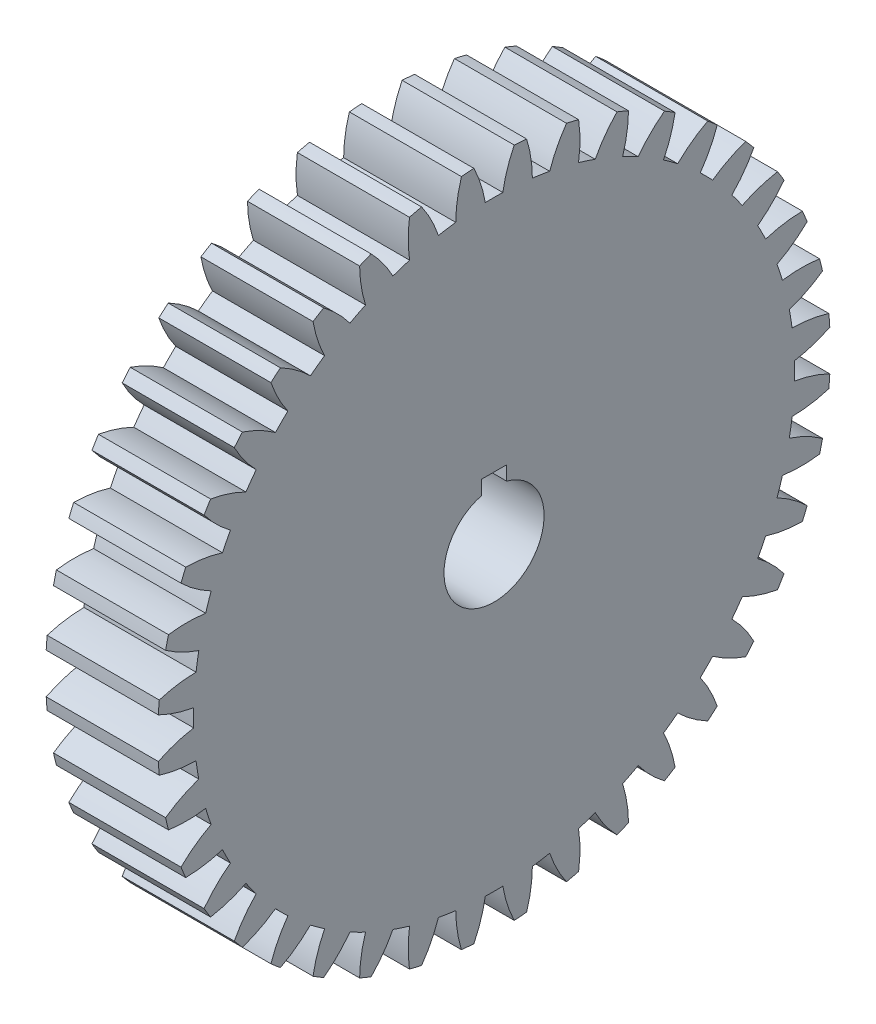
from build123d import *

# Parameters (mm, degrees)
SPUR_START             = -37.075031189
SPUR_GEAR_AI_OUTLINE_R = 3.96875
SPUR_GEAR_AI_DEPTH     = 8.89
SKETCH1_W              = 2
SKETCH1_H              = 2
CUT_EXTRUDE1_DEPTH     = 55.357122206


# Read off the part's stored shape, not the designer's step: spur gear_ai
with BuildPart() as part:
    # spur gear_ai outline → spur gear_ai (new body)
    with BuildSketch(Plane.YZ.offset(SPUR_START)):
        with BuildLine():
            ThreePointArc((34.87337661, 6.70347613), (34.993144006, 7.182744544), (35.104013782, 7.664149087))
            ThreePointArc((35.104013782, 7.664149087), (33.837241458, 8.426572892), (32.473226216, 8.997067938))
            ThreePointArc((32.473226216, 8.997067938), (32.591910481, 9.681649982), (32.690582523, 10.36940165))
            ThreePointArc((32.690582523, 10.36940165), (34.164130772, 10.49047079), (35.604504757, 10.824124742))
            ThreePointArc((35.604504757, 10.824124742), (35.64782352, 11.316228315), (35.682020042, 11.809049824))
            ThreePointArc((35.682020042, 11.809049824), (34.311574428, 12.363920075), (32.87510739, 12.714012386))
            ThreePointArc((32.87510739, 12.714012386), (32.885238229, 13.408732398), (32.87510739, 14.10345241))
            ThreePointArc((32.87510739, 14.10345241), (34.311574428, 14.453544721), (35.682020042, 15.008414972))
            ThreePointArc((35.682020042, 15.008414972), (35.64782352, 15.501236481), (35.604504757, 15.993340054))
            ThreePointArc((35.604504757, 15.993340054), (34.164130771, 16.326994005), (32.690582523, 16.448063146))
            ThreePointArc((32.690582523, 16.448063146), (32.591910481, 17.135814814), (32.473226216, 17.820396858))
            ThreePointArc((32.473226216, 17.820396858), (33.837241458, 18.390891904), (35.104013782, 19.153315708))
            ThreePointArc((35.104013782, 19.153315708), (34.993144006, 19.634720252), (34.87337661, 20.113988666))
            ThreePointArc((34.87337661, 20.113988666), (33.398541041, 20.21821065), (31.924195231, 20.107275496))
            ThreePointArc((31.924195231, 20.107275496), (31.719149941, 20.771124092), (31.494834651, 21.428711486))
            ThreePointArc((31.494834651, 21.428711486), (32.752811514, 22.205561785), (33.884718408, 23.156765738))
            ThreePointArc((33.884718408, 23.156765738), (33.699905361, 23.614899539), (33.506638403, 24.069531615))
            ThreePointArc((33.506638403, 24.069531615), (32.033656597, 23.94175534), (30.594816511, 23.601547484))
            ThreePointArc((30.594816511, 23.601547484), (30.288446869, 24.225146852), (29.96402394, 24.839547611))
            ThreePointArc((29.96402394, 24.839547611), (31.08498686, 25.803624532), (32.05415702, 26.920186836))
            ThreePointArc((32.05415702, 26.920186836), (31.799951412, 27.343769119), (31.537943765, 27.762570306))
            ThreePointArc((31.537943765, 27.762570306), (30.103085423, 27.405942048), (28.73518008, 26.844838537))
            ThreePointArc((28.73518008, 26.844838537), (28.335029924, 27.412833591), (27.918487725, 27.968919129))
            ThreePointArc((27.918487725, 27.968919129), (28.874834874, 29.096483898), (29.657404114, 30.350911083))
            ThreePointArc((29.657404114, 30.350911083), (29.340065332, 30.729511847), (29.015768494, 31.102169871))
            ThreePointArc((29.015768494, 31.102169871), (27.654364589, 30.525471001), (26.391076359, 29.757288064))
            ThreePointArc((26.391076359, 29.757288064), (25.906998712, 30.255692881), (25.408593896, 30.739770528))
            ThreePointArc((25.408593896, 30.739770528), (26.176776832, 32.003058759), (26.753475702, 33.364462663))
            ThreePointArc((26.753475702, 33.364462663), (26.380817678, 33.6887595), (26.002216914, 34.006098283))
            ThreePointArc((26.002216914, 34.006098283), (24.74778973, 33.223529042), (23.620224961, 32.267181894))
            ThreePointArc((23.620224961, 32.267181894), (23.064139422, 32.683724092), (22.496144368, 33.083874249))
            ThreePointArc((22.496144368, 33.083874249), (23.05724788, 34.451779592), (23.413876138, 35.886637934))
            ThreePointArc((23.413876138, 35.886637934), (22.99507495, 36.148645581), (22.571492667, 36.402851189))
            ThreePointArc((22.571492667, 36.402851189), (21.454930363, 35.433681029), (20.490853442, 34.312718109))
            ThreePointArc((20.490853442, 34.312718109), (19.876452683, 34.637141038), (19.252853315, 34.94351068))
            ThreePointArc((19.252853315, 34.94351068), (19.593061171, 36.382350766), (19.720837446, 37.855332572))
            ThreePointArc((19.720837446, 37.855332572), (19.26620537, 38.04859953), (18.80807157, 38.233412577))
            ThreePointArc((18.80807157, 38.233412577), (17.856867617, 37.101505683), (17.080017317, 35.843528819))
            ThreePointArc((17.080017317, 35.843528819), (16.422429923, 36.06784411), (15.758581327, 36.2728894))
            ThreePointArc((15.758581327, 36.2728894), (15.869516481, 37.74723521), (15.765294497, 39.222070779))
            ThreePointArc((15.765294497, 39.222070779), (15.286026083, 39.341838175), (14.80462154, 39.452707951))
            ThreePointArc((14.80462154, 39.452707951), (14.042197735, 38.185935627), (13.471702689, 36.821920385))
            ThreePointArc((13.471702689, 36.821920385), (12.787120645, 36.94060465), (12.099368977, 37.039276692))
            ThreePointArc((12.099368977, 37.039276692), (11.978299837, 38.512824941), (11.644645885, 39.953198926))
            ThreePointArc((11.644645885, 39.953198926), (11.152542312, 39.996517689), (10.659720803, 40.030714211))
            ThreePointArc((10.659720803, 40.030714211), (10.104850552, 38.660268597), (9.754758241, 37.223801559))
            ThreePointArc((9.754758241, 37.223801559), (9.060038229, 37.233932398), (8.365318217, 37.223801559))
            ThreePointArc((8.365318217, 37.223801559), (8.015225906, 38.660268597), (7.460355655, 40.030714211))
            ThreePointArc((7.460355655, 40.030714211), (6.967534146, 39.996517689), (6.475430573, 39.953198926))
            ThreePointArc((6.475430573, 39.953198926), (6.141776622, 38.51282494), (6.020707481, 37.039276692))
            ThreePointArc((6.020707481, 37.039276692), (5.332955813, 36.94060465), (4.648373769, 36.821920385))
            ThreePointArc((4.648373769, 36.821920385), (4.077878723, 38.185935627), (3.315454919, 39.452707951))
            ThreePointArc((3.315454919, 39.452707951), (2.834050375, 39.341838175), (2.354781961, 39.222070779))
            ThreePointArc((2.354781961, 39.222070779), (2.250559977, 37.74723521), (2.361495131, 36.2728894))
            ThreePointArc((2.361495131, 36.2728894), (1.697646535, 36.06784411), (1.040059141, 35.843528819))
            ThreePointArc((1.040059141, 35.843528819), (0.263208842, 37.101505683), (-0.687995111, 38.233412577))
            ThreePointArc((-0.687995111, 38.233412577), (-1.146128912, 38.04859953), (-1.600760988, 37.855332572))
            ThreePointArc((-1.600760988, 37.855332572), (-1.472984713, 36.382350766), (-1.132776857, 34.94351068))
            ThreePointArc((-1.132776857, 34.94351068), (-1.756376225, 34.637141038), (-2.370776984, 34.312718109))
            ThreePointArc((-2.370776984, 34.312718109), (-3.334853905, 35.433681029), (-4.451416209, 36.402851189))
            ThreePointArc((-4.451416209, 36.402851189), (-4.874998492, 36.148645581), (-5.293799679, 35.886637934))
            ThreePointArc((-5.293799679, 35.886637934), (-4.937171421, 34.451779592), (-4.37606791, 33.083874249))
            ThreePointArc((-4.37606791, 33.083874249), (-4.944062964, 32.683724092), (-5.500148502, 32.267181894))
            ThreePointArc((-5.500148502, 32.267181894), (-6.627713271, 33.223529042), (-7.882140456, 34.006098283))
            ThreePointArc((-7.882140456, 34.006098283), (-8.26074122, 33.6887595), (-8.633399244, 33.364462663))
            ThreePointArc((-8.633399244, 33.364462663), (-8.056700374, 32.003058758), (-7.288517437, 30.739770528))
            ThreePointArc((-7.288517437, 30.739770528), (-7.786922254, 30.255692881), (-8.270999901, 29.757288064))
            ThreePointArc((-8.270999901, 29.757288064), (-9.534288131, 30.525471001), (-10.895692036, 31.102169871))
            ThreePointArc((-10.895692036, 31.102169871), (-11.219988873, 30.729511847), (-11.537327656, 30.350911083))
            ThreePointArc((-11.537327656, 30.350911083), (-10.754758415, 29.096483899), (-9.798411267, 27.968919129))
            ThreePointArc((-9.798411267, 27.968919129), (-10.214953465, 27.412833591), (-10.615103622, 26.844838537))
            ThreePointArc((-10.615103622, 26.844838537), (-11.983008965, 27.405942048), (-13.417867307, 27.762570306))
            ThreePointArc((-13.417867307, 27.762570306), (-13.679874954, 27.343769119), (-13.934080562, 26.920186836))
            ThreePointArc((-13.934080562, 26.920186836), (-12.964910402, 25.803624533), (-11.843947482, 24.839547611))
            ThreePointArc((-11.843947482, 24.839547611), (-12.168370411, 24.225146852), (-12.474740053, 23.601547484))
            ThreePointArc((-12.474740053, 23.601547484), (-13.913580139, 23.94175534), (-15.386561945, 24.069531615))
            ThreePointArc((-15.386561945, 24.069531615), (-15.579828903, 23.614899539), (-15.76464195, 23.156765738))
            ThreePointArc((-15.76464195, 23.156765738), (-14.632735056, 22.205561785), (-13.374758192, 21.428711486))
            ThreePointArc((-13.374758192, 21.428711486), (-13.599073483, 20.771124092), (-13.804118773, 20.107275496))
            ThreePointArc((-13.804118773, 20.107275496), (-15.278464583, 20.21821065), (-16.753300152, 20.113988666))
            ThreePointArc((-16.753300152, 20.113988666), (-16.873067548, 19.634720252), (-16.983937324, 19.153315708))
            ThreePointArc((-16.983937324, 19.153315708), (-15.717165, 18.390891904), (-14.353149758, 17.820396858))
            ThreePointArc((-14.353149758, 17.820396858), (-14.471834023, 17.135814814), (-14.570506065, 16.448063146))
            ThreePointArc((-14.570506065, 16.448063146), (-16.044054313, 16.326994005), (-17.484428299, 15.993340054))
            ThreePointArc((-17.484428299, 15.993340054), (-17.527747062, 15.501236481), (-17.561943584, 15.008414972))
            ThreePointArc((-17.561943584, 15.008414972), (-16.19149797, 14.453544721), (-14.755030932, 14.10345241))
            ThreePointArc((-14.755030932, 14.10345241), (-14.765161771, 13.408732398), (-14.755030932, 12.714012386))
            ThreePointArc((-14.755030932, 12.714012386), (-16.19149797, 12.363920075), (-17.561943584, 11.809049824))
            ThreePointArc((-17.561943584, 11.809049824), (-17.527747062, 11.316228315), (-17.484428299, 10.824124742))
            ThreePointArc((-17.484428299, 10.824124742), (-16.044054314, 10.49047079), (-14.570506065, 10.36940165))
            ThreePointArc((-14.570506065, 10.36940165), (-14.471834023, 9.681649982), (-14.353149758, 8.997067938))
            ThreePointArc((-14.353149758, 8.997067938), (-15.717165, 8.426572892), (-16.983937324, 7.664149087))
            ThreePointArc((-16.983937324, 7.664149087), (-16.873067548, 7.182744544), (-16.753300152, 6.70347613))
            ThreePointArc((-16.753300152, 6.70347613), (-15.278464583, 6.599254146), (-13.804118773, 6.7101893))
            ThreePointArc((-13.804118773, 6.7101893), (-13.599073483, 6.046340704), (-13.374758192, 5.38875331))
            ThreePointArc((-13.374758192, 5.38875331), (-14.632735056, 4.61190301), (-15.76464195, 3.660699057))
            ThreePointArc((-15.76464195, 3.660699057), (-15.579828903, 3.202565257), (-15.386561945, 2.747933181))
            ThreePointArc((-15.386561945, 2.747933181), (-13.913580139, 2.875709456), (-12.474740053, 3.215917312))
            ThreePointArc((-12.474740053, 3.215917312), (-12.168370411, 2.592317944), (-11.843947482, 1.977917185))
            ThreePointArc((-11.843947482, 1.977917185), (-12.964910402, 1.013840263), (-13.934080562, -0.10272204))
            ThreePointArc((-13.934080562, -0.10272204), (-13.679874954, -0.526304323), (-13.417867307, -0.945105511))
            ThreePointArc((-13.417867307, -0.945105511), (-11.983008965, -0.588477253), (-10.615103622, -0.027373741))
            ThreePointArc((-10.615103622, -0.027373741), (-10.214953465, -0.595368795), (-9.798411267, -1.151454334))
            ThreePointArc((-9.798411267, -1.151454334), (-10.754758415, -2.279019103), (-11.537327656, -3.533446287))
            ThreePointArc((-11.537327656, -3.533446287), (-11.219988873, -3.912047051), (-10.895692036, -4.284705075))
            ThreePointArc((-10.895692036, -4.284705075), (-9.534288132, -3.708006205), (-8.270999901, -2.939823269))
            ThreePointArc((-8.270999901, -2.939823269), (-7.786922254, -3.438228085), (-7.288517437, -3.922305732))
            ThreePointArc((-7.288517437, -3.922305732), (-8.056700374, -5.185593962), (-8.633399244, -6.546997867))
            ThreePointArc((-8.633399244, -6.546997867), (-8.26074122, -6.871294705), (-7.882140456, -7.188633487))
            ThreePointArc((-7.882140456, -7.188633487), (-6.627713271, -6.406064246), (-5.500148502, -5.449717098))
            ThreePointArc((-5.500148502, -5.449717098), (-4.944062964, -5.866259296), (-4.37606791, -6.266409453))
            ThreePointArc((-4.37606791, -6.266409453), (-4.937171421, -7.634314796), (-5.293799679, -9.069173138))
            ThreePointArc((-5.293799679, -9.069173138), (-4.874998492, -9.331180785), (-4.451416209, -9.585386393))
            ThreePointArc((-4.451416209, -9.585386393), (-3.334853905, -8.616216233), (-2.370776984, -7.495253313))
            ThreePointArc((-2.370776984, -7.495253313), (-1.756376225, -7.819676242), (-1.132776857, -8.126045884))
            ThreePointArc((-1.132776857, -8.126045884), (-1.472984713, -9.56488597), (-1.600760988, -11.037867776))
            ThreePointArc((-1.600760988, -11.037867776), (-1.146128912, -11.231134734), (-0.687995111, -11.415947781))
            ThreePointArc((-0.687995111, -11.415947781), (0.263208842, -10.284040887), (1.040059141, -9.026064024))
            ThreePointArc((1.040059141, -9.026064024), (1.697646535, -9.250379314), (2.361495131, -9.455424604))
            ThreePointArc((2.361495131, -9.455424604), (2.250559977, -10.929770414), (2.354781961, -12.404605983))
            ThreePointArc((2.354781961, -12.404605983), (2.834050375, -12.524373379), (3.315454919, -12.635243155))
            ThreePointArc((3.315454919, -12.635243155), (4.077878723, -11.368470831), (4.648373769, -10.004455589))
            ThreePointArc((4.648373769, -10.004455589), (5.332955813, -10.123139854), (6.020707481, -10.221811896))
            ThreePointArc((6.020707481, -10.221811896), (6.141776622, -11.695360144), (6.475430573, -13.13573413))
            ThreePointArc((6.475430573, -13.13573413), (6.967534146, -13.179052893), (7.460355655, -13.213249415))
            ThreePointArc((7.460355655, -13.213249415), (8.015225906, -11.842803801), (8.365318217, -10.406336763))
            ThreePointArc((8.365318217, -10.406336763), (9.060038229, -10.416467602), (9.754758241, -10.406336763))
            ThreePointArc((9.754758241, -10.406336763), (10.104850552, -11.842803801), (10.659720803, -13.213249415))
            ThreePointArc((10.659720803, -13.213249415), (11.152542312, -13.179052893), (11.644645885, -13.13573413))
            ThreePointArc((11.644645885, -13.13573413), (11.978299837, -11.695360145), (12.099368977, -10.221811896))
            ThreePointArc((12.099368977, -10.221811896), (12.787120645, -10.123139854), (13.471702689, -10.004455589))
            ThreePointArc((13.471702689, -10.004455589), (14.042197735, -11.368470831), (14.80462154, -12.635243155))
            ThreePointArc((14.80462154, -12.635243155), (15.286026083, -12.524373379), (15.765294497, -12.404605983))
            ThreePointArc((15.765294497, -12.404605983), (15.869516481, -10.929770414), (15.758581327, -9.455424604))
            ThreePointArc((15.758581327, -9.455424604), (16.422429923, -9.250379314), (17.080017317, -9.026064024))
            ThreePointArc((17.080017317, -9.026064024), (17.856867617, -10.284040887), (18.80807157, -11.415947781))
            ThreePointArc((18.80807157, -11.415947781), (19.26620537, -11.231134734), (19.720837446, -11.037867776))
            ThreePointArc((19.720837446, -11.037867776), (19.593061171, -9.56488597), (19.252853315, -8.126045884))
            ThreePointArc((19.252853315, -8.126045884), (19.876452683, -7.819676242), (20.490853442, -7.495253313))
            ThreePointArc((20.490853442, -7.495253313), (21.454930363, -8.616216233), (22.571492667, -9.585386393))
            ThreePointArc((22.571492667, -9.585386393), (22.99507495, -9.331180785), (23.413876138, -9.069173138))
            ThreePointArc((23.413876138, -9.069173138), (23.05724788, -7.634314796), (22.496144368, -6.266409453))
            ThreePointArc((22.496144368, -6.266409453), (23.064139422, -5.866259296), (23.620224961, -5.449717098))
            ThreePointArc((23.620224961, -5.449717098), (24.74778973, -6.406064246), (26.002216914, -7.188633487))
            ThreePointArc((26.002216914, -7.188633487), (26.380817678, -6.871294705), (26.753475702, -6.546997867))
            ThreePointArc((26.753475702, -6.546997867), (26.176776832, -5.185593963), (25.408593896, -3.922305732))
            ThreePointArc((25.408593896, -3.922305732), (25.906998712, -3.438228085), (26.391076359, -2.939823269))
            ThreePointArc((26.391076359, -2.939823269), (27.65436459, -3.708006205), (29.015768494, -4.284705075))
            ThreePointArc((29.015768494, -4.284705075), (29.340065332, -3.912047051), (29.657404114, -3.533446287))
            ThreePointArc((29.657404114, -3.533446287), (28.874834874, -2.279019103), (27.918487725, -1.151454334))
            ThreePointArc((27.918487725, -1.151454334), (28.335029924, -0.595368795), (28.73518008, -0.027373741))
            ThreePointArc((28.73518008, -0.027373741), (30.103085423, -0.588477253), (31.537943765, -0.945105511))
            ThreePointArc((31.537943765, -0.945105511), (31.799951412, -0.526304323), (32.05415702, -0.10272204))
            ThreePointArc((32.05415702, -0.10272204), (31.08498686, 1.013840264), (29.96402394, 1.977917185))
            ThreePointArc((29.96402394, 1.977917185), (30.288446869, 2.592317944), (30.594816511, 3.215917312))
            ThreePointArc((30.594816511, 3.215917312), (32.033656597, 2.875709456), (33.506638403, 2.747933181))
            ThreePointArc((33.506638403, 2.747933181), (33.699905361, 3.202565257), (33.884718408, 3.660699057))
            ThreePointArc((33.884718408, 3.660699057), (32.752811514, 4.61190301), (31.494834651, 5.38875331))
            ThreePointArc((31.494834651, 5.38875331), (31.719149941, 6.046340704), (31.924195231, 6.7101893))
            ThreePointArc((31.924195231, 6.7101893), (33.398541041, 6.599254146), (34.87337661, 6.70347613))
        make_face()
        with Locations((9.060038229, 13.408732398)):
            Circle(SPUR_GEAR_AI_OUTLINE_R, mode=Mode.SUBTRACT)
    extrude(amount=SPUR_GEAR_AI_DEPTH)

    # Sketch1 → Cut-Extrude1 (cut, through all)
    with BuildSketch(Plane(origin=(-28.185031189, 0, 0), x_dir=(0, 0, -1), z_dir=(1, 0, 0))):
        with Locations((-13.408732398, 13.028788229)):
            Rectangle(SKETCH1_W, SKETCH1_H)
    extrude(amount=-CUT_EXTRUDE1_DEPTH, mode=Mode.SUBTRACT)


solid = part.part
